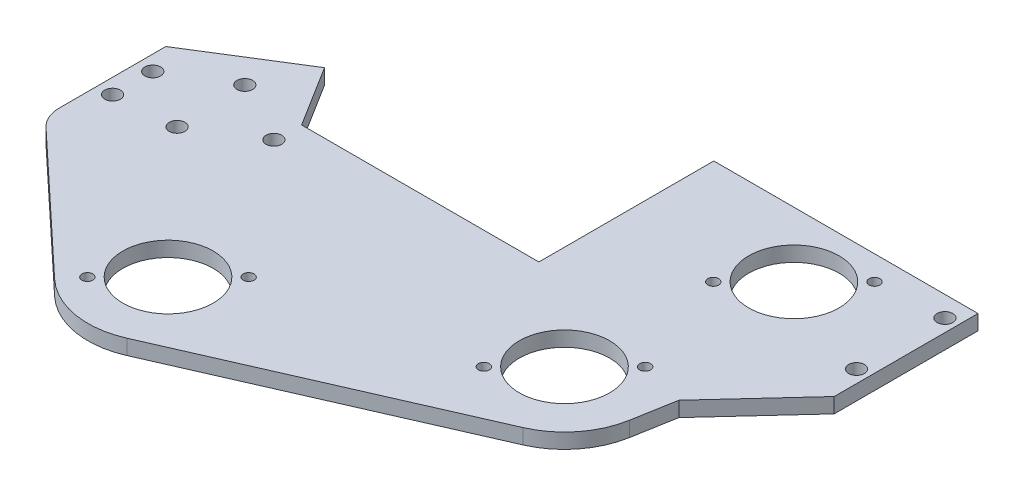
from build123d import *

# Parameters (mm, degrees)
SKETCH1_R                 = 14.29004
BOSS_EXTRUDE1_DEPTH       = 4.7625
FILLET1_R                 = 10
F_10_CLEARANCE_HOLE1_D    = 4.9784
F_10_CLEARANCE_HOLE2_D    = 4.9784
TAP_DRILL_FOR_8_32_TAP1_D = 3.4544


with BuildPart() as part:
    # Sketch1 → Boss-Extrude1 (new body)
    with BuildSketch(Plane(origin=(0, 0, 0), x_dir=(1, 0, 0), z_dir=(0, 1, 0))):
        with BuildLine():
            Line((-62.038222018, -79.883349745), (25.167081601, -41.695780276))
            ThreePointArc((25.167081601, -41.695780276), (34.91524479, -34.148496119), (39.940188099, -22.890693115))
            Line((39.940188099, -22.890693115), (42.275148896, -9.586739751))
            Line((42.275148896, -9.586739751), (65.831008632, 16.012754812))
            Line((65.831008632, 16.012754812), (65.831008632, 61.493591694))
            Line((65.831008632, 61.493591694), (-17.734439664, 61.493591694))
            Line((-17.734439664, 61.493591694), (-17.734439664, 6.164335762))
            Line((-17.734439664, 6.164335762), (-92.776174625, 6.164335762))
            Line((-92.776174625, 6.164335762), (-104.850431309, 25.487185645))
            Line((-104.850431309, 25.487185645), (-135.754362541, 6.176266165))
            Line((-135.754362541, 6.176266165), (-135.754362541, -31.923733805))
            Line((-135.754362541, -31.923733805), (-89.58881583, -75.156212804))
            ThreePointArc((-89.58881583, -75.156212804), (-76.522282462, -81.650581076), (-62.038222018, -79.883349745))
        make_face()
        with Locations((28.046575186, 41.045834415)):
            Circle(SKETCH1_R, mode=Mode.SUBTRACT)
        with Locations((15.031008632, -18.508482198)):
            Circle(SKETCH1_R, mode=Mode.SUBTRACT)
        with Locations((-72.258332946, -56.628468385)):
            Circle(SKETCH1_R, mode=Mode.SUBTRACT)
    extrude(amount=BOSS_EXTRUDE1_DEPTH)

    # Fillet1
    fillet1_edges = [part.edges().sort_by_distance(p)[0] for p in [
        (-135.754362541, 2.38125, 31.923733805),
    ]]
    fillet(fillet1_edges, radius=FILLET1_R)

    # #10 Clearance Hole1 (through all)
    with Locations(Plane(origin=(0, 4.7625, 0), x_dir=(1, 0, 0), z_dir=(0, 1, 0))):
        with Locations((61.830508632, 55.015834415), (61.830508632, 27.075834415), (-130.991862541, -2.725664238), (-130.991862541, -15.425664238)):
            Hole(F_10_CLEARANCE_HOLE1_D / 2)

    # #10 Clearance Hole2 (through all)
    with Locations(Plane(origin=(0, 4.7625, 0), x_dir=(1, 0, 0), z_dir=(0, 1, 0))):
        with Locations((-111.967153366, -14.051247514), (-93.119284429, -2.273791866), (-112.732400526, 8.143579493)):
            Hole(F_10_CLEARANCE_HOLE2_D / 2)

    # Tap Drill for #8-32 Tap1 (through all)
    with Locations(Plane(origin=(0, 4.7625, 0), x_dir=(1, 0, 0), z_dir=(0, 1, 0))):
        with Locations((-59.506369254, -43.876504694), (-85.010296638, -69.380432077), (2.27904494, -31.26044589), (27.782972324, -5.756518506), (15.294611495, 28.293870723), (40.798538878, 53.797798107)):
            Hole(TAP_DRILL_FOR_8_32_TAP1_D / 2)


solid = part.part
